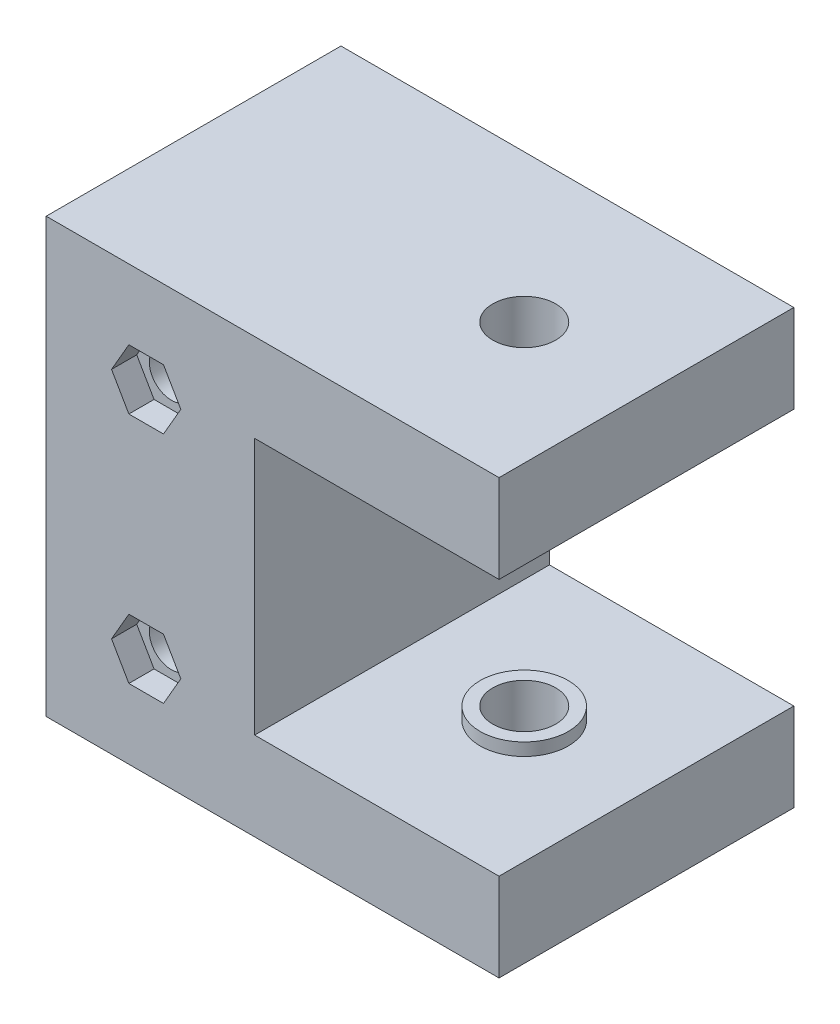
from build123d import *

# Parameters (mm, degrees)
MAINBLOCK_R                     = 1.75
MAINBLOCKBOSS_EXTRUDE1_DEPTH    = 23.4
TOPHOLECUT_SKETCH2_R            = 2.5
TOPHOLECUT_EXTRUDE1_DEPTH       = 30
MOUNTHOLEBORECUT_EXTRUDE2_DEPTH = 2
TOPSPACERSKETCH4_R              = 3.5
TOPSPACERSKETCH4_R_2            = 2.5
TOPSPACERBOSS_EXTRUDE2_DEPTH    = 1
LOWERSPACERBOSS_EXTRUDE3_START  = 1
LOWERSPACERSKETCH5_R            = 3.5
LOWERSPACERSKETCH5_R_2          = 2.5
LOWERSPACERBOSS_EXTRUDE3_DEPTH  = 1
PUSHPINHOLESKETCH1_R            = 1
PUSHPINHOLECUT_EXTRUDE1_DEPTH   = 55.984747885


with BuildPart() as part:
    # MainBlock → MainBlockBoss-Extrude1 (new body)
    with BuildSketch(Plane.XY):
        Polygon((0, 0), (35.95, 0), (35.95, 7), (16.55, 7), (16.55, 27.4), (35.95, 27.4), (35.95, 34.4), (0, 34.4), align=None)
        with Locations((7.9375, 26.4625)):
            Circle(MAINBLOCK_R, mode=Mode.SUBTRACT)
        with Locations((7.9375, 7.9375)):
            Circle(MAINBLOCK_R, mode=Mode.SUBTRACT)
    extrude(amount=MAINBLOCKBOSS_EXTRUDE1_DEPTH)

    # TopHoleCut-Sketch2 → TopHoleCut-Extrude1 (cut)
    with BuildSketch(Plane(origin=(0, 34.4, 0), x_dir=(1, 0, 0), z_dir=(0, 1, 0))):
        with Locations((26.25, -11.7)):
            Circle(TOPHOLECUT_SKETCH2_R)
    extrude(amount=-TOPHOLECUT_EXTRUDE1_DEPTH, mode=Mode.SUBTRACT)

    # MountHoleBoreSketch3 → MountHoleBoreCut-Extrude2 (cut)
    with BuildSketch(Plane.XY.offset(23.4)):
        Polygon((10.6875, 26.4625), (9.3125, 28.84406986), (6.5625, 28.84406986), (5.1875, 26.4625), (6.5625, 24.08093014), (9.3125, 24.08093014), align=None)
        Polygon((10.6875, 7.9375), (9.3125, 10.31906986), (6.5625, 10.31906986), (5.1875, 7.9375), (6.5625, 5.55593014), (9.3125, 5.55593014), align=None)
    extrude(amount=-MOUNTHOLEBORECUT_EXTRUDE2_DEPTH, mode=Mode.SUBTRACT)

    # TopSpacerSketch4 → TopSpacerBoss-Extrude2 (add)
    with BuildSketch(Plane.XZ.offset(-27.4)):
        with Locations((26.25, 11.7)):
            Circle(TOPSPACERSKETCH4_R)
        with Locations((26.25, 11.7)):
            Circle(TOPSPACERSKETCH4_R_2, mode=Mode.SUBTRACT)
    extrude(amount=TOPSPACERBOSS_EXTRUDE2_DEPTH)

    # LowerSpacerSketch5 → LowerSpacerBoss-Extrude3 (add)
    with BuildSketch(Plane(origin=(0, 7, 0), x_dir=(1, 0, 0), z_dir=(0, 1, 0)).offset(LOWERSPACERBOSS_EXTRUDE3_START)):
        with Locations((26.25, -11.7)):
            Circle(LOWERSPACERSKETCH5_R)
        with Locations((26.25, -11.7)):
            Circle(LOWERSPACERSKETCH5_R_2, mode=Mode.SUBTRACT)
    extrude(amount=-LOWERSPACERBOSS_EXTRUDE3_DEPTH)

    # PushPinHoleSketch1 → PushPinHoleCut-Extrude1 (cut, through all)
    with BuildSketch(Plane.XZ):
        with Locations((26.25, 11.7)):
            Circle(PUSHPINHOLESKETCH1_R)
    extrude(amount=-PUSHPINHOLECUT_EXTRUDE1_DEPTH, mode=Mode.SUBTRACT)


solid = part.part
